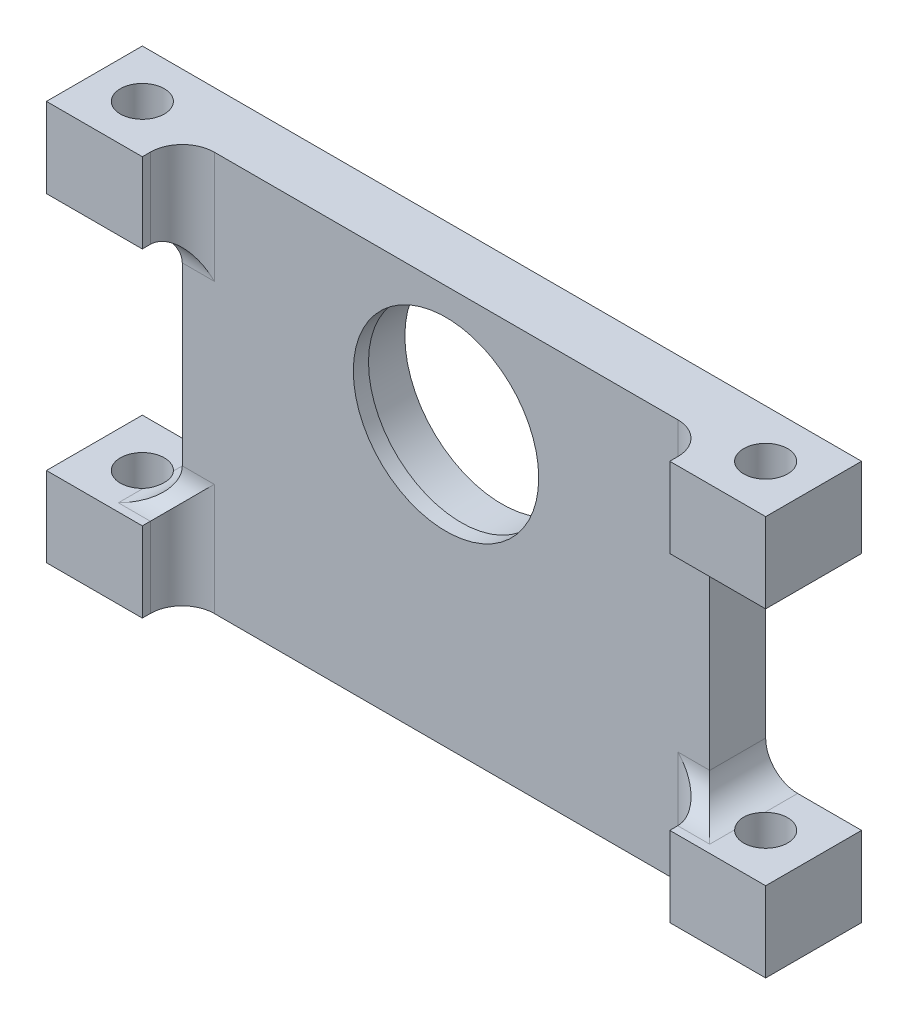
from build123d import *
from build123d.topology import SkipClean

# Parameters (mm, degrees)
BOSS_EXTRUDE1_DEPTH = 7
SKETCH2_W           = 12
SKETCH2_H           = 10
BOSS_EXTRUDE2_DEPTH = 12
FILLET1_R           = 4
FILLET2_R           = 4
SKETCH3_R           = 2.75
CUT_EXTRUDE1_DEPTH  = 104.653269711
SKETCH4_R           = 12.15
CUT_EXTRUDE2_DEPTH  = 5.1


with BuildPart() as part:
    # Sketch1 → Boss-Extrude1 (new body)
    with BuildSketch(Plane.XY):
        with BuildLine():
            Line((45.000001788, 50), (78.000001788, 50))
            Line((78.000001788, 50), (78.000001788, 0))
            Line((78.000001788, 0), (45.000001788, 0))
            Line((45.000001788, 0), (45.000001788, 23.4))
            ThreePointArc((45.000001788, 23.4), (56.600001788, 35), (45.000001788, 46.6))
            Line((45.000001788, 46.6), (45.000001788, 50))
        make_face()
    extrude(amount=BOSS_EXTRUDE1_DEPTH)

    # Sketch2 → Boss-Extrude2 (add)
    with BuildSketch(Plane(origin=(0, 0, 0), x_dir=(-1, 0, 0), z_dir=(0, 0, -1))):
        with Locations((-84.000001788, 45)):
            Rectangle(SKETCH2_W, SKETCH2_H)
        with Locations((-84.000001788, 5)):
            Rectangle(SKETCH2_W, SKETCH2_H)
    extrude(amount=-BOSS_EXTRUDE2_DEPTH)

    # Fillet1
    fillet1_edges = [part.edges().sort_by_distance(p)[0] for p in [
        (78.000001788, 40, 3.5),
        (78.000001788, 10, 3.5),
    ]]
    fillet(fillet1_edges, radius=FILLET1_R)

    # Fillet2
    fillet2_edges = [part.edges().sort_by_distance(p)[0] for p in [
        (78.000001788, 5, 7),
        (80.000001788, 10, 7),
        (78.000001788, 45, 7),
        (80.000001788, 40, 7),
    ]]
    fillet(fillet2_edges, radius=FILLET2_R - 0.0001)  # a hair under: the kernel refuses the full size

    # Sketch3 → Cut-Extrude1 (cut, through all)
    with BuildSketch(Plane(origin=(0, 50, 0), x_dir=(1, 0, 0), z_dir=(0, 1, 0))):
        with Locations(Location((84.000001788, -6, 0), (0, 0, 270))):
            Circle(SKETCH3_R)
    extrude(amount=-CUT_EXTRUDE1_DEPTH, mode=Mode.SUBTRACT)

    # Sketch4 → Cut-Extrude2 (cut)
    with BuildSketch(Plane(origin=(0, 0, 0), x_dir=(-1, 0, 0), z_dir=(0, 0, -1))):
        with Locations((-45.000001788, 35)):
            Circle(SKETCH4_R)
    extrude(amount=-CUT_EXTRUDE2_DEPTH, mode=Mode.SUBTRACT)

    # Mirror1: part across plane


with BuildPart() as part_1:
    with SkipClean():  # the faces are left unmerged after this step: merging them gives an invalid solid
        add(part.part)
        add(part.part.mirror(Plane(origin=(45.000001788, 23.4, 7), x_dir=(0, 0, 1), z_dir=(1, 0, 0))))


solid = part_1.part
